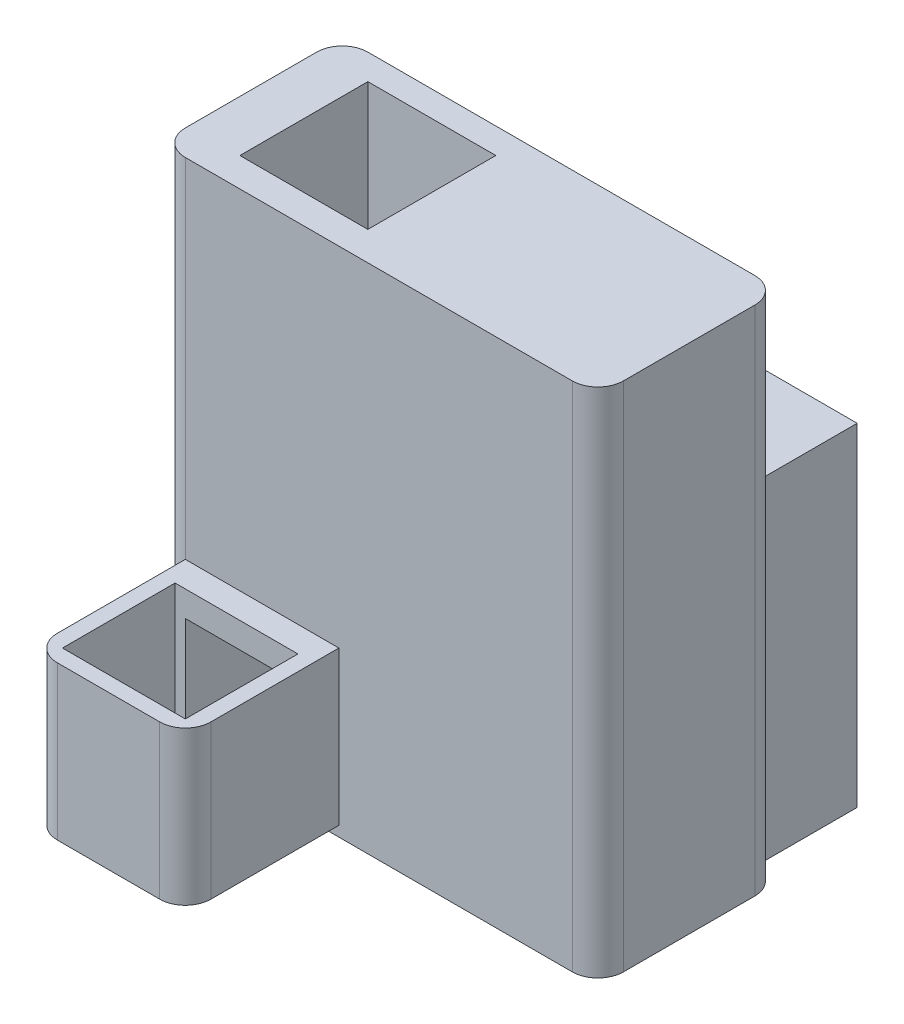
from build123d import *

# Parameters (mm, degrees)
CROQUIS1_W                 = 85.6
CROQUIS1_H                 = 35.66
SALIENTE_EXTRUIR1_DEPTH    = 100
CROQUIS2_W                 = 25
CROQUIS2_H                 = 25
CORTAR_EXTRUIR1_DEPTH      = 92
CROQUIS3_W                 = 30
CROQUIS3_H                 = 30
SALIENTE_EXTRUIR2_DEPTH    = 30
CROQUIS4_W                 = 24
CROQUIS4_H                 = 22
CORTAR_EXTRUIR2_DEPTH      = 30
REDONDEO1_R                = 5
CROQUIS8_W                 = 75.6
CROQUIS8_H                 = 65
SALIENTE_EXTRUIR3_DEPTH    = 20
CORTAR_EXTRUIR3_DEPTH      = 10
CORTAR_EXTRUIR3_DEPTH_BACK = 10
CROQUIS6_W                 = 20
CROQUIS6_H                 = 20
CROQUIS9_W                 = 24
CROQUIS9_H                 = 22
SALIENTE_EXTRUIR4_DEPTH    = 2
SALIENTE_EXTRUIR4_TAPER    = 60
CROQUIS10_W                = 17.07179677
CROQUIS10_H                = 15.07179677
CORTAR_EXTRUIR4_DEPTH      = 2
CORTAR_EXTRUIR4_DRAFT      = 25
CROQUIS12_W                = 65.6
CROQUIS12_H                = 55
CORTAR_EXTRUIR6_DEPTH      = 20
CROQUIS17_W                = 30
CROQUIS17_H                = 55
CORTAR_EXTRUIR11_DEPTH     = 30


with BuildPart() as part:
    # Croquis1 → Saliente-Extruir1 (new body)
    with BuildSketch(Plane(origin=(0, 0, 0), x_dir=(1, 0, 0), z_dir=(0, 1, 0))):
        Rectangle(CROQUIS1_W, CROQUIS1_H)
    extrude(amount=SALIENTE_EXTRUIR1_DEPTH)

    # Croquis2 → Cortar-Extruir1 (cut)
    with BuildSketch(Plane(origin=(0, 100, 0), x_dir=(1, 0, 0), z_dir=(0, 1, 0))):
        with Locations((-20.3, 0.33)):
            Rectangle(CROQUIS2_W, CROQUIS2_H)
    extrude(amount=-CORTAR_EXTRUIR1_DEPTH, mode=Mode.SUBTRACT)

    # Croquis3 → Saliente-Extruir2 (add)
    with BuildSketch(Plane.XY.offset(17.83)):
        with Locations((-22.8, 17)):
            Rectangle(CROQUIS3_W, CROQUIS3_H)
    extrude(amount=SALIENTE_EXTRUIR2_DEPTH)

    # Croquis4 → Cortar-Extruir2 (cut)
    with BuildSketch(Plane.XZ.offset(-2)):
        with Locations((-22.8, 33.83)):
            Rectangle(CROQUIS4_W, CROQUIS4_H)
    extrude(amount=-CORTAR_EXTRUIR2_DEPTH, mode=Mode.SUBTRACT)

    # Redondeo1
    redondeo1_edges = [part.edges().sort_by_distance(p)[0] for p in [
        (-7.8, 17, 47.83),
        (-37.8, 17, 47.83),
        (42.8, 50, 17.83),
        (-42.8, 50, 17.83),
        (-42.8, 50, -17.83),
        (42.8, 50, -17.83),
    ]]
    fillet(redondeo1_edges, radius=REDONDEO1_R - 0.0001)  # a hair under: the kernel refuses the full size

    # Croquis8 → Saliente-Extruir3 (add)
    with BuildSketch(Plane(origin=(0, 0, -17.83), x_dir=(-1, 0, 0), z_dir=(0, 0, -1))):
        with Locations((0, 32.5)):
            Rectangle(CROQUIS8_W, CROQUIS8_H)
    extrude(amount=SALIENTE_EXTRUIR3_DEPTH)

    # Croquis6 → Cortar-Extruir3 (cut, two sides: drawn at the far end of the back side and taken through both)
    with BuildSketch(Plane.XY.offset(17.83).offset(-CORTAR_EXTRUIR3_DEPTH_BACK)):
        with Locations((-22.8, 17)):
            Rectangle(CROQUIS6_W, CROQUIS6_H)
    extrude(amount=CORTAR_EXTRUIR3_DEPTH + CORTAR_EXTRUIR3_DEPTH_BACK, mode=Mode.SUBTRACT)

    # Croquis12 → Cortar-Extruir6 (cut)
    with BuildSketch(Plane(origin=(0, 0, -37.83), x_dir=(-1, 0, 0), z_dir=(0, 0, -1))):
        with Locations((0, 32.5)):
            Rectangle(CROQUIS12_W, CROQUIS12_H)
    extrude(amount=-CORTAR_EXTRUIR6_DEPTH, mode=Mode.SUBTRACT)

    # Croquis17 → Cortar-Extruir11 (cut)
    with BuildSketch(Plane(origin=(0, 0, -17.83), x_dir=(-1, 0, 0), z_dir=(0, 0, -1))):
        with Locations((-17.8, 32.5)):
            Rectangle(CROQUIS17_W, CROQUIS17_H)
    extrude(amount=-CORTAR_EXTRUIR11_DEPTH, mode=Mode.SUBTRACT)


with BuildPart() as body_2:
    # Croquis9 → Saliente-Extruir4 (new body)
    with BuildSketch(Plane.XZ.offset(-2)):
        with Locations((-22.8, 33.83)):
            Rectangle(CROQUIS9_W, CROQUIS9_H)
    extrude(amount=SALIENTE_EXTRUIR4_DEPTH, taper=SALIENTE_EXTRUIR4_TAPER)


with BuildPart() as cortar_extruir4_tool:
    # Croquis10 → Cortar-Extruir4 (with draft: the straight prism first)
    with BuildSketch(Plane.XZ):
        with Locations((-22.8, 33.83)):
            Rectangle(CROQUIS10_W, CROQUIS10_H)
    extrude(amount=-CORTAR_EXTRUIR4_DEPTH)
    # Cortar-Extruir4: the draft: its side faces are tilted about the plane it starts from
    cortar_extruir4_sides = [cortar_extruir4_tool.faces().sort_by_distance(p)[0] for p in [
        (-22.8, 1, 26.294101615),
        (-14.264101615, 1, 33.83),
        (-22.8, 1, 41.365898385),
        (-31.335898385, 1, 33.83),
    ]]
    draft(cortar_extruir4_sides, Plane.XZ, CORTAR_EXTRUIR4_DRAFT)


with BuildPart() as body_2_1:
    add(body_2.part)

    # Cortar-Extruir4: cut by cortar_extruir4_tool
    add(cortar_extruir4_tool.part, mode=Mode.SUBTRACT)


solid = Compound([part.part, body_2_1.part])
